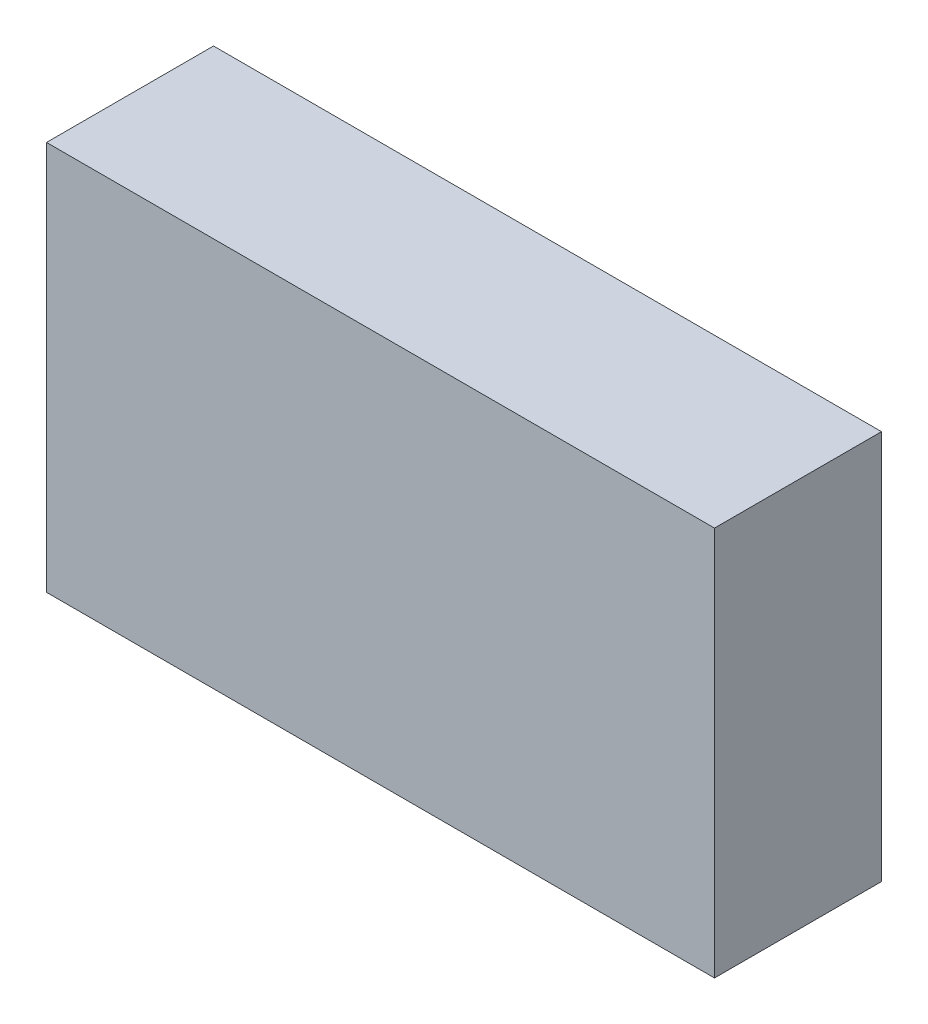
from build123d import *

# Parameters (mm, degrees)
SKETCH1_W           = 152.4
SKETCH1_H           = 88.9
BOSS_EXTRUDE1_DEPTH = 38.1


with BuildPart() as part:
    # Sketch1 → Boss-Extrude1 (new body)
    with BuildSketch(Plane.XY):
        with Locations((44.035869565, 133.211956522)):
            Rectangle(SKETCH1_W, SKETCH1_H)
    extrude(amount=BOSS_EXTRUDE1_DEPTH)


solid = part.part
